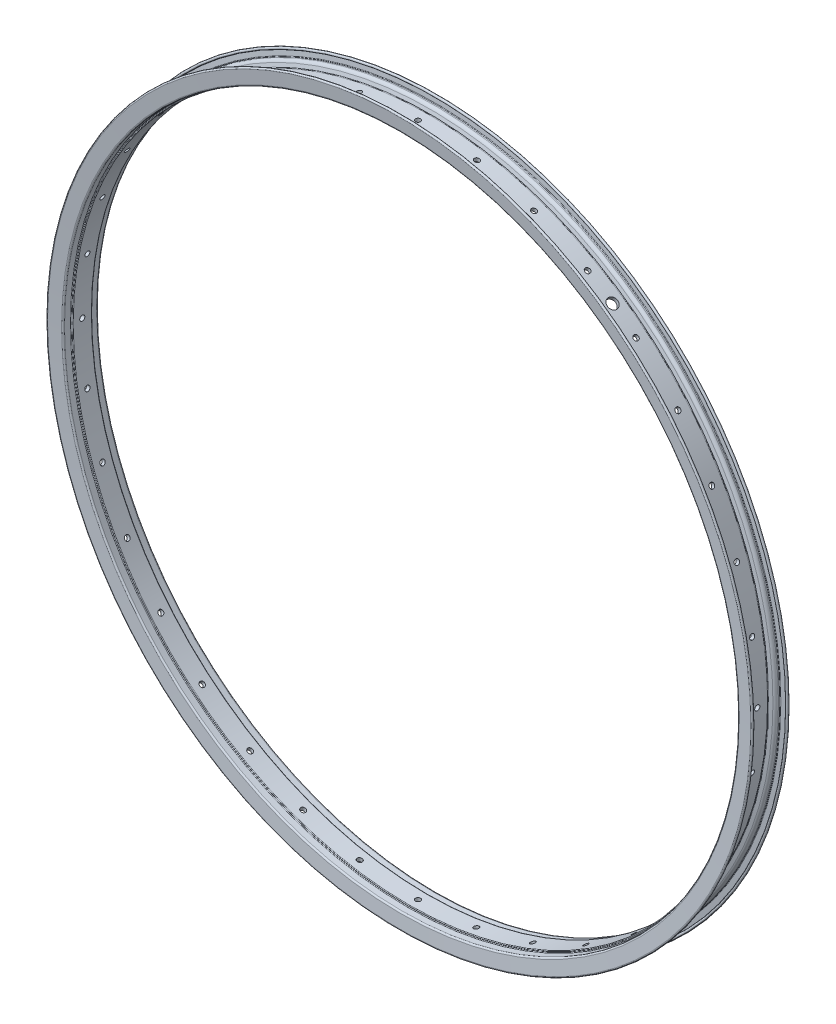
from build123d import *

# Parameters (mm, degrees)
CROQUIS2_R            = 2.1
CORTAR_EXTRUIR1_DEPTH = 408.724146468
MATRIZC1_COUNT        = 36
CORTAR_EXTRUIR2_REACH = 684.001
CROQUIS4_R            = 4.2


with BuildPart() as part:
    # Croquis1 → Revolución1 (revolve)
    with BuildSketch(Plane(origin=(0, 0, 0), x_dir=(0, 0, -1), z_dir=(1, 0, 0))):
        with BuildLine():
            Line((7.359611797, 274), (-7.359611797, 274))
            ThreePointArc((-7.359611797, 274), (-7.753714516, 274.192293895), (-7.844683047, 274.621267813))
            Line((-7.844683047, 274.621267813), (-7.805316953, 274.778732187))
            ThreePointArc((-7.805316953, 274.778732187), (-7.896285484, 275.207706105), (-8.290388203, 275.4))
            Line((-8.290388203, 275.4), (-13.112874711, 275.4))
            ThreePointArc((-13.112874711, 275.4), (-13.954024128, 275.725355388), (-14.357297553, 276.532051747))
            Line((-14.357297553, 276.532051747), (-15.35, 287.005641398))
            ThreePointArc((-15.35, 287.005641398), (-13.71723147, 287.870673472), (-14.260103124, 286.104461726))
            Line((-14.260103124, 286.104461726), (-13.897247491, 282.276123215))
            ThreePointArc((-13.897247491, 282.276123215), (-13.735938121, 281.953444672), (-13.399478354, 281.823302516))
            Line((-13.399478354, 281.823302516), (-12.399478354, 281.823302516))
            ThreePointArc((-12.399478354, 281.823302516), (-10.783934578, 281.298727938), (-9.784734943, 279.925134013))
            Line((-9.784734943, 279.925134013), (-8.912433749, 277.247557742))
            ThreePointArc((-8.912433749, 277.247557742), (-8.730761088, 276.997813391), (-8.437025856, 276.902436195))
            Line((-8.437025856, 276.902436195), (8.437025856, 276.902436195))
            ThreePointArc((8.437025856, 276.902436195), (8.730761088, 276.997813391), (8.912433749, 277.247557742))
            Line((8.912433749, 277.247557742), (9.784734943, 279.925134013))
            ThreePointArc((9.784734943, 279.925134013), (10.783934578, 281.298727938), (12.399478354, 281.823302516))
            Line((12.399478354, 281.823302516), (13.399478354, 281.823302516))
            ThreePointArc((13.399478354, 281.823302516), (13.735938121, 281.953444672), (13.897247491, 282.276123215))
            Line((13.897247491, 282.276123215), (14.260103124, 286.104461726))
            ThreePointArc((14.260103124, 286.104461726), (13.71723147, 287.870673472), (15.35, 287.005641398))
            Line((15.35, 287.005641398), (14.357297553, 276.532051747))
            ThreePointArc((14.357297553, 276.532051747), (13.954024128, 275.725355388), (13.112874711, 275.4))
            Line((13.112874711, 275.4), (8.290388203, 275.4))
            ThreePointArc((8.290388203, 275.4), (7.896285484, 275.207706105), (7.805316953, 274.778732187))
            Line((7.805316953, 274.778732187), (7.844683047, 274.621267813))
            ThreePointArc((7.844683047, 274.621267813), (7.753714516, 274.192293895), (7.359611797, 274))
        make_face()
    revolve(axis=Axis((0, 0, 255.624615883), (0, 0, -1)))

    # Croquis2 → Cortar-Extruir1 (cut, through all)
    with BuildSketch(Plane(origin=(0, 0, 0), x_dir=(1, 0, 0), z_dir=(0, 1, 0))):
        Circle(CROQUIS2_R)
    cortar_extruir1 = extrude(amount=-CORTAR_EXTRUIR1_DEPTH, mode=Mode.SUBTRACT)

    # MatrizC1: Cortar-Extruir1 ×36 about axis
    matrizc1_axis = Axis((0, 0, -7.359611797), (0, 0, 1))
    for i in range(1, MATRIZC1_COUNT):
        add(cortar_extruir1.rotate(matrizc1_axis, i * 360 / MATRIZC1_COUNT), mode=Mode.SUBTRACT)

    # Croquis4 → Cortar-Extruir2 (cut, up to next)
    with BuildSketch(Plane(origin=(158.824712853, 226.825197101, 0), x_dir=(0.8191520443100039, -0.5735764363210377, 0), z_dir=(0.5735764363210377, 0.8191520443100039, 0)), mode=Mode.PRIVATE) as cortar_extruir2_sk1:
        Circle(CROQUIS4_R)
    cortar_extruir2_tool1 = extrude(cortar_extruir2_sk1.sketch, amount=-CORTAR_EXTRUIR2_REACH, mode=Mode.PRIVATE) & part.part
    add(cortar_extruir2_tool1.solids().sort_by_distance((158.824713, 226.825197, 0))[0], mode=Mode.SUBTRACT)


solid = part.part
